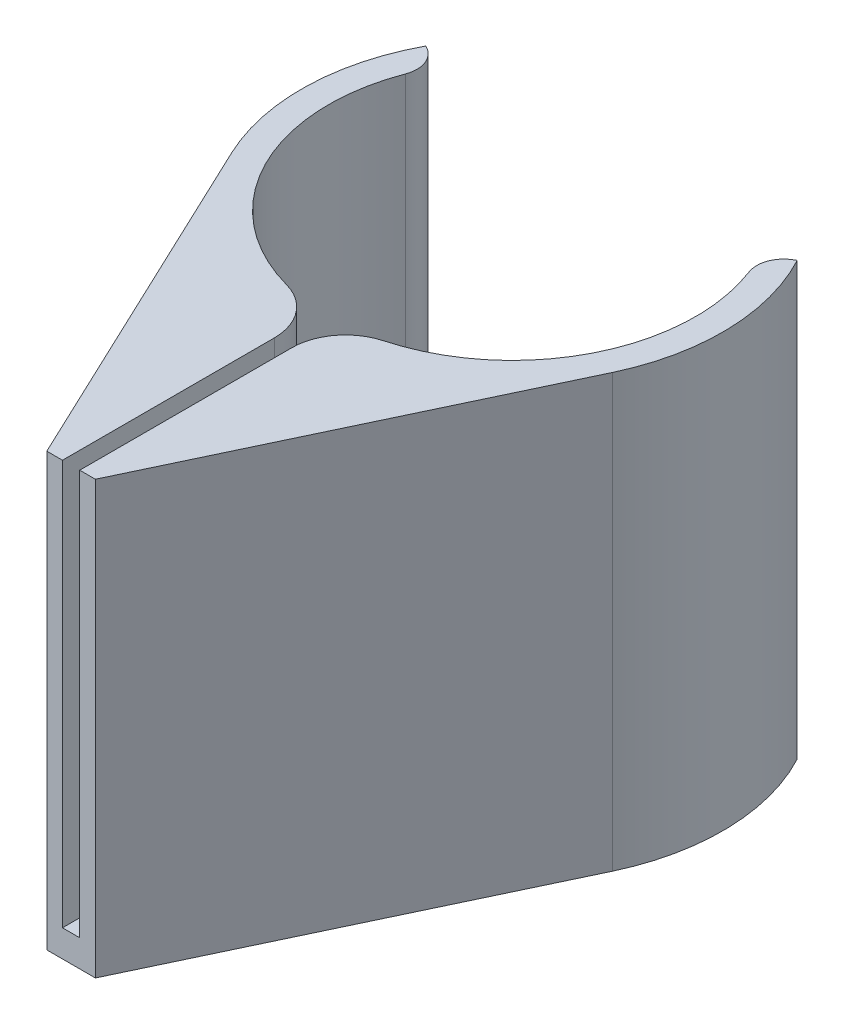
from build123d import *

# Parameters (mm, degrees)
FIN_SLOT_EXTRUDE_DEPTH = 80
FIN_START              = -75
FIN_SLOT_DEPTH         = 75
FILLET1_R              = 10
FILLET2_R              = 5


with BuildPart() as part:
    # Sketch2 → Fin slot extrude (new body)
    with BuildSketch(Plane(origin=(0, 0, 0), x_dir=(1, 0, 0), z_dir=(0, 1, 0))):
        with BuildLine():
            Line((-35.253910446, -16.678183302), (-4.5, -81.685))
            Line((-4.5, -81.685), (4.5, -81.685))
            Line((4.5, -81.685), (35.253910446, -16.678183302))
            ThreePointArc((35.253910446, -16.678183302), (38.987980591, 0.968178408), (34.382638025, 18.407449646))
            Line((34.382638025, 18.407449646), (30.049957519, 15.90597539))
            ThreePointArc((30.049957519, 15.90597539), (0, -34), (-30.049957519, 15.90597539))
            Line((-30.049957519, 15.90597539), (-34.382638025, 18.407449646))
            ThreePointArc((-34.382638025, 18.407449646), (-38.987980591, 0.968178408), (-35.253910446, -16.678183302))
        make_face()
    extrude(amount=FIN_SLOT_EXTRUDE_DEPTH)

    # Sketch3 → Fin slot (cut)
    with BuildSketch(Plane(origin=(0, 80, 0), x_dir=(1, 0, 0), z_dir=(0, 1, 0)).offset(FIN_START)):
        with BuildLine():
            Line((1.6, -81.685), (1.6, -33.962332075))
            ThreePointArc((1.6, -33.962332075), (0, -34), (-1.6, -33.962332075))
            Line((-1.6, -33.962332075), (-1.6, -81.685))
            Line((-1.6, -81.685), (1.6, -81.685))
        make_face()
    extrude(amount=FIN_SLOT_DEPTH, mode=Mode.SUBTRACT)

    # Fillet1
    # the kernel refuses this fillet: 10 mm, written as the material it takes off along each edge
    with BuildSketch(Plane(origin=(-1.6, 5, 33.962332075), x_dir=(0, 0, 1), z_dir=(0, 1, 0))) as fillet1_piece_1:
        with BuildLine():
            CenterArc((8.481041966, -10), FILLET1_R, 90, 74.714058958)
            Line((-1.165179407, -7.363636364), (-1.358103835, -7.310909091))
            ThreePointArc((-1.358103835, -7.310909091), (-0.577691759, -3.682593204), (-0.199778424, 0.009411765))
            Line((-0.199778424, 0.009411765), (0, 0.2))
            Line((0, 0.2), (8.481041966, 0.2))
            Line((8.481041966, 0.2), (8.481041966, 0))
        make_face()
    extrude(amount=75, mode=Mode.SUBTRACT)
    with BuildSketch(Plane(origin=(1.6, 5, 33.962332075), x_dir=(0, 0, 1), z_dir=(0, 1, 0))) as fillet1_piece_2:
        with BuildLine():
            CenterArc((8.481041966, 10), FILLET1_R, 195.285941042, 74.714058958)
            Line((-1.165179407, 7.363636364), (-1.358103835, 7.310909091))
            ThreePointArc((-1.358103835, 7.310909091), (-0.577691759, 3.682593204), (-0.199778424, -0.009411765))
            Line((-0.199778424, -0.009411765), (0, -0.2))
            Line((0, -0.2), (8.481041966, -0.2))
            Line((8.481041966, -0.2), (8.481041966, 0))
        make_face()
    extrude(amount=75, mode=Mode.SUBTRACT)
    with BuildSketch(Plane(origin=(0, 5, 0), x_dir=(0.7049632922211216, 0, 0.7092437920918008), z_dir=(0.7092437920918008, 0, -0.7049632922211216))) as fillet1_piece_3_section:
        with BuildLine():
            CenterArc((34 + FILLET1_R, FILLET1_R), FILLET1_R, 180, 90)
            Line((34, FILLET1_R), (34 - FILLET1_R * 0.02, FILLET1_R))
            Line((34 - FILLET1_R * 0.02, FILLET1_R), (34 - FILLET1_R * 0.02, -FILLET1_R * 0.02))
            Line((34 - FILLET1_R * 0.02, -FILLET1_R * 0.02), (34 + FILLET1_R, -FILLET1_R * 0.02))
            Line((34 + FILLET1_R, -FILLET1_R * 0.02), (34 + FILLET1_R, 0))
        make_face()
    fillet1_piece_3 = revolve(axis=Axis((0, 5, 0), (0, -1, 0)), revolution_arc=89.653157122, mode=Mode.PRIVATE)
    fillet1_piece_3 = split(fillet1_piece_3, bisect_by=Plane(origin=(1.6, 2.736001805, 36.252063161), z_dir=(-1, 0, 0)), keep=Keep.TOP, mode=Mode.PRIVATE)
    fillet1_piece_3 = split(fillet1_piece_3, bisect_by=Plane(origin=(-1.6, 2.736001805, 36.252063161), z_dir=(1, 0, 0)), keep=Keep.TOP, mode=Mode.PRIVATE)
    add(fillet1_piece_3, mode=Mode.SUBTRACT)
    with BuildSketch(Plane(origin=(0, 5, 0), x_dir=(0.7049632922211216, 0, 0.7092437920918008), z_dir=(0.7092437920918008, 0, -0.7049632922211216))) as fillet1_piece_4a_section:
        with BuildLine():
            CenterArc((34 + FILLET1_R, FILLET1_R), FILLET1_R, 180, 90)
            Line((34, FILLET1_R), (34 - FILLET1_R * 0.02, FILLET1_R))
            Line((34 - FILLET1_R * 0.02, FILLET1_R), (34 - FILLET1_R * 0.02, -FILLET1_R * 0.02))
            Line((34 - FILLET1_R * 0.02, -FILLET1_R * 0.02), (34 + FILLET1_R, -FILLET1_R * 0.02))
            Line((34 + FILLET1_R, -FILLET1_R * 0.02), (34 + FILLET1_R, 0))
        make_face()
    fillet1_piece_4a = revolve(axis=Axis((0, 5, 0), (0, -1, 0)), revolution_arc=89.653157122, mode=Mode.PRIVATE)
    fillet1_piece_4a = split(fillet1_piece_4a, bisect_by=Plane(origin=(-1.6, 2.81629174, 32.584573329), z_dir=(-1, 0, 0)), keep=Keep.TOP, mode=Mode.PRIVATE)
    with BuildSketch(Plane(origin=(-1.6, -16.202604914, 33.962332075), x_dir=(0, 0, 1), z_dir=(0, 1, 0))) as fillet1_piece_4b_section:
        with BuildLine():
            CenterArc((8.481041966, -10), FILLET1_R, 90, 74.714058958)
            Line((-1.165179407, -7.363636364), (-1.358103835, -7.310909091))
            ThreePointArc((-1.358103835, -7.310909091), (-0.577691759, -3.682593204), (-0.199778424, 0.009411765))
            Line((-0.199778424, 0.009411765), (0, 0.2))
            Line((0, 0.2), (8.481041966, 0.2))
            Line((8.481041966, 0.2), (8.481041966, 0))
        make_face()
    fillet1_piece_4b = extrude(amount=96.202604914, mode=Mode.PRIVATE)
    fillet1_piece_4b = split(fillet1_piece_4b, bisect_by=Plane(origin=(-3.235617235, 5, 35.755925785), z_dir=(0, -1, 0)), keep=Keep.TOP, mode=Mode.PRIVATE)
    fillet1_piece_4 = fillet1_piece_4a & fillet1_piece_4b
    add(fillet1_piece_4, mode=Mode.SUBTRACT)
    with BuildSketch(Plane(origin=(1.6, -16.202604914, 33.962332075), x_dir=(0, 0, 1), z_dir=(0, 1, 0))) as fillet1_piece_5a_section:
        with BuildLine():
            CenterArc((8.481041966, 10), FILLET1_R, 195.285941042, 74.714058958)
            Line((-1.165179407, 7.363636364), (-1.358103835, 7.310909091))
            ThreePointArc((-1.358103835, 7.310909091), (-0.577691759, 3.682593204), (-0.199778424, -0.009411765))
            Line((-0.199778424, -0.009411765), (0, -0.2))
            Line((0, -0.2), (8.481041966, -0.2))
            Line((8.481041966, -0.2), (8.481041966, 0))
        make_face()
    fillet1_piece_5a = extrude(amount=96.202604914, mode=Mode.PRIVATE)
    fillet1_piece_5a = split(fillet1_piece_5a, bisect_by=Plane(origin=(3.235617235, 5, 35.755925785), z_dir=(0, -1, 0)), keep=Keep.TOP, mode=Mode.PRIVATE)
    with BuildSketch(Plane(origin=(0, 5, 0), x_dir=(0.7049632922211216, 0, 0.7092437920918008), z_dir=(0.7092437920918008, 0, -0.7049632922211216))) as fillet1_piece_5b_section:
        with BuildLine():
            CenterArc((34 + FILLET1_R, FILLET1_R), FILLET1_R, 180, 90)
            Line((34, FILLET1_R), (34 - FILLET1_R * 0.02, FILLET1_R))
            Line((34 - FILLET1_R * 0.02, FILLET1_R), (34 - FILLET1_R * 0.02, -FILLET1_R * 0.02))
            Line((34 - FILLET1_R * 0.02, -FILLET1_R * 0.02), (34 + FILLET1_R, -FILLET1_R * 0.02))
            Line((34 + FILLET1_R, -FILLET1_R * 0.02), (34 + FILLET1_R, 0))
        make_face()
    fillet1_piece_5b = revolve(axis=Axis((0, 5, 0), (0, -1, 0)), revolution_arc=89.653157122, mode=Mode.PRIVATE)
    fillet1_piece_5b = split(fillet1_piece_5b, bisect_by=Plane(origin=(1.6, 2.816291902, 32.584573464), z_dir=(1, 0, 0)), keep=Keep.TOP, mode=Mode.PRIVATE)
    fillet1_piece_5 = fillet1_piece_5a & fillet1_piece_5b
    add(fillet1_piece_5, mode=Mode.SUBTRACT)

    # Fillet2
    fillet2_edges = [part.edges().sort_by_distance(p)[0] for p in [
        (-30.049957519, 40, -15.90597539),
        (30.049957519, 40, -15.90597539),
    ]]
    fillet(fillet2_edges, radius=FILLET2_R)


solid = part.part
